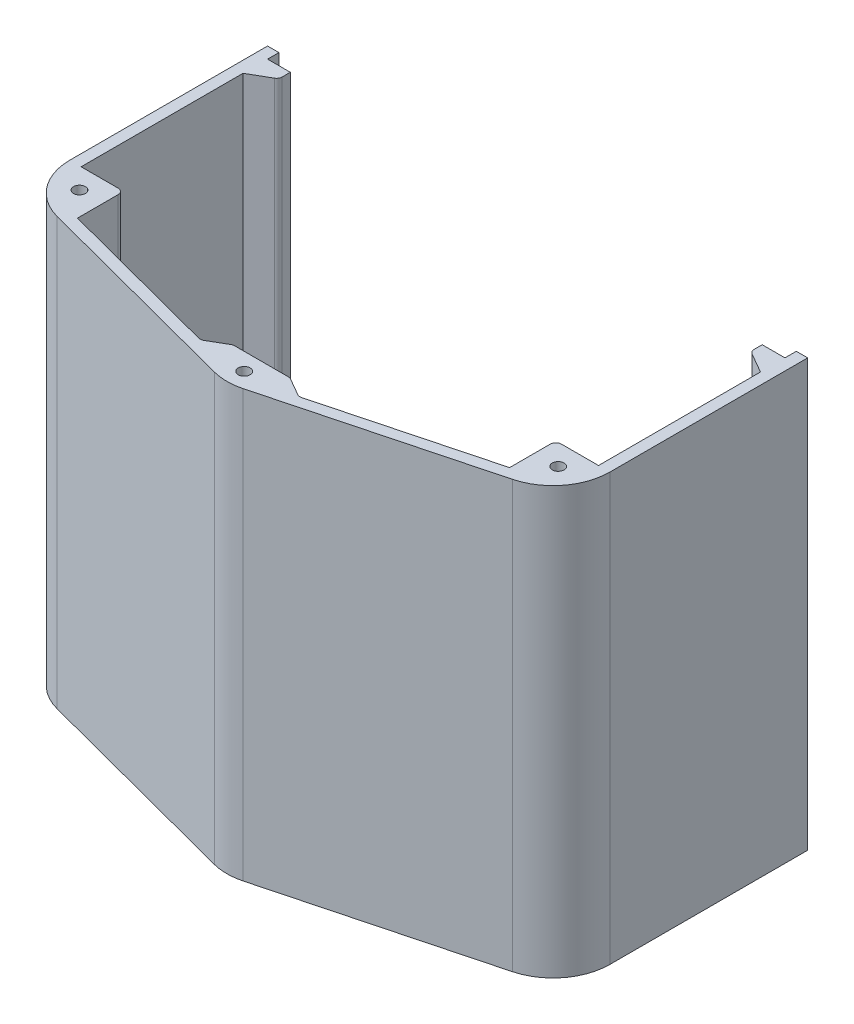
from build123d import *

# Parameters (mm, degrees)
BOSS_EXTRUDE1_DEPTH = 150
SHELL2_T            = -4
BOSS_EXTRUDE2_DEPTH = 150
FILLET1_R           = 2
SKETCH4_R           = 2.1
CUT_EXTRUDE1_DEPTH  = 150
SKETCH5_W           = 166
SKETCH5_H           = 2.845299462
BOSS_EXTRUDE3_DEPTH = 10
BOSS_EXTRUDE6_DEPTH = 150
FILLET2_R           = 2
SKETCH7_R           = 2.1
CUT_EXTRUDE3_DEPTH  = 150


with BuildPart() as part:
    # Sketch1 → Boss-Extrude1 (new body)
    with BuildSketch(Plane(origin=(0, 0, 0), x_dir=(1, 0, 0), z_dir=(0, 1, 0))):
        with BuildLine():
            Line((95, 0), (95, -69.582228732))
            ThreePointArc((95, -69.582228732), (90.839780928, -81.792934696), (80.089865986, -88.923719477))
            Line((80.089865986, -88.923719477), (5.089865986, -108.660561583))
            ThreePointArc((5.089865986, -108.660561583), (0, -109.319070837), (-5.089865986, -108.660561583))
            Line((-5.089865986, -108.660561583), (-80.089865986, -88.923719477))
            ThreePointArc((-80.089865986, -88.923719477), (-90.839780928, -81.792934696), (-95, -69.582228732))
            Line((-95, -69.582228732), (-95, 0))
            Line((-95, 0), (95, 0))
        make_face()
    extrude(amount=BOSS_EXTRUDE1_DEPTH)

    # Shell2
    shell2_openings = [part.faces().sort_by_distance(p)[0] for p in [
        (0, 0, 48.84344893),
        (0, 75, 0),
        (0, 150, 48.84344893),
    ]]
    offset(amount=SHELL2_T, openings=shell2_openings, kind=Kind.INTERSECTION)

    # Sketch3 → Boss-Extrude2 (add)
    with BuildSketch(Plane(origin=(0, 0, 0), x_dir=(1, 0, 0), z_dir=(0, 1, 0))):
        Polygon((-91, -4), (-83, -4), (-83, -8), (-91, -12.618802154), align=None)
        Polygon((-91, -69.582228732), (-76, -69.582228732), (-76, -85.863814167), (-80.300337087, -88.867104329), (-90.839780928, -81.792934696), (-95, -69.582228732), align=None)
        Polygon((91, -69.582228732), (76, -69.582228732), (76, -85.863814167), (80.300337087, -88.867104329), (90.839780928, -81.792934696), (95, -69.582228732), align=None)
        Polygon((83, -8), (91, -12.618802154), (91, -4), (83, -4), align=None)
    extrude(amount=BOSS_EXTRUDE2_DEPTH)

    # Fillet1
    fillet1_edges = [part.edges().sort_by_distance(p)[0] for p in [
        (83, 75, 8),
        (-83, 75, 8),
        (-76, 75, 69.582228732),
        (76, 75, 69.582228732),
    ]]
    fillet(fillet1_edges, radius=FILLET1_R)

    # Sketch4 → Cut-Extrude1 (cut)
    with BuildSketch(Plane(origin=(0, 0, 0), x_dir=(1, 0, 0), z_dir=(0, 1, 0))):
        with Locations((84.197294702, -76.966150565)):
            Circle(SKETCH4_R)
        with Locations((-84.197294702, -76.966150565)):
            Circle(SKETCH4_R)
    extrude(amount=CUT_EXTRUDE1_DEPTH, mode=Mode.SUBTRACT)

    # Sketch5 → Boss-Extrude3 (add)
    with BuildSketch(Plane(origin=(0, 0, 0), x_dir=(1, 0, 0), z_dir=(0, 1, 0))):
        with Locations((0, -5.422649731)):
            Rectangle(SKETCH5_W, SKETCH5_H)
    extrude(amount=BOSS_EXTRUDE3_DEPTH)

    # Sketch6 → Boss-Extrude6 (add)
    with BuildSketch(Plane(origin=(0, 0, 0), x_dir=(1, 0, 0), z_dir=(0, 1, 0))):
        Polygon((10, -97.119070837), (17.273176686, -101.318241355), (0, -107.972122026), (-17.273176686, -101.318241355), (-10, -97.119070837), align=None)
    extrude(amount=BOSS_EXTRUDE6_DEPTH)

    # Fillet2
    fillet2_edges = [part.edges().sort_by_distance(p)[0] for p in [
        (17.273176686, 75, 101.318241355),
        (10, 75, 97.119070837),
        (-17.273176686, 75, 101.318241355),
        (-10, 75, 97.119070837),
    ]]
    fillet(fillet2_edges, radius=FILLET2_R)

    # Sketch7 → Cut-Extrude3 (cut)
    with BuildSketch(Plane(origin=(0, 0, 0), x_dir=(1, 0, 0), z_dir=(0, 1, 0))):
        with Locations((0, -103.219070837)):
            Circle(SKETCH7_R)
    extrude(amount=CUT_EXTRUDE3_DEPTH, mode=Mode.SUBTRACT)


solid = part.part
